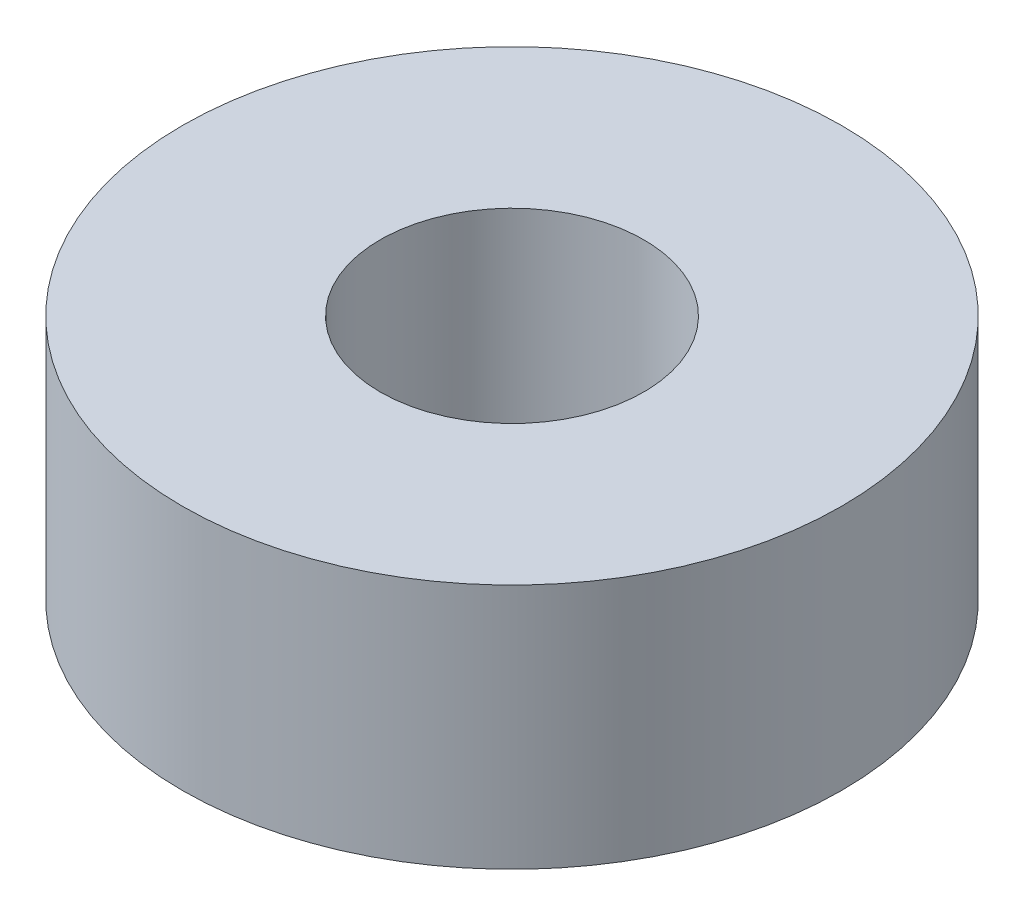
from build123d import *

# Parameters (mm, degrees)
SKETCH1_R           = 37.5
BOSS_EXTRUDE1_DEPTH = 28
SKETCH2_R           = 15
CUT_EXTRUDE1_DEPTH  = 60.970826241


with BuildPart() as part:
    # Sketch1 → Boss-Extrude1 (new body)
    with BuildSketch(Plane(origin=(0, 0, 0), x_dir=(1, 0, 0), z_dir=(0, 1, 0))):
        Circle(SKETCH1_R)
    extrude(amount=BOSS_EXTRUDE1_DEPTH)

    # Sketch2 → Cut-Extrude1 (cut, through all)
    with BuildSketch(Plane(origin=(0, 0, 0), x_dir=(1, 0, 0), z_dir=(0, 1, 0))):
        Circle(SKETCH2_R)
    extrude(amount=CUT_EXTRUDE1_DEPTH, mode=Mode.SUBTRACT)


solid = part.part
